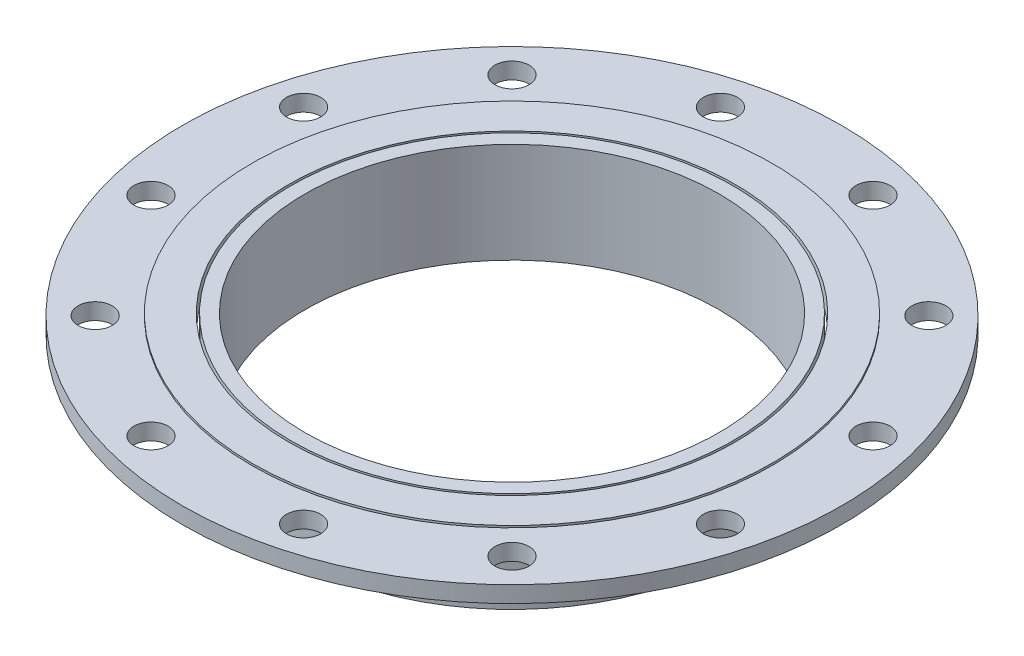
from build123d import *

# Parameters (mm, degrees)
SKETCH9_R           = 241.5
SKETCH9_R_2         = 163.6
BOSS_EXTRUDE1_DEPTH = 12
SKETCH10_R          = 12.5
CUT_EXTRUDE1_DEPTH  = 12
CIRPATTERN1_COUNT   = 12
SKETCH11_R          = 190.5
SKETCH11_R_2        = 163.6
BOSS_EXTRUDE2_DEPTH = 1.5
SKETCH12_R          = 161.95
SKETCH12_R_2        = 151.64
BOSS_EXTRUDE3_DEPTH = 73.5


with BuildPart() as part:
    # Sketch9 → Boss-Extrude1 (new body)
    with BuildSketch(Plane(origin=(0, 400, 0), x_dir=(1, 0, 0), z_dir=(0, 1, 0))):
        Circle(SKETCH9_R)
        Circle(SKETCH9_R_2, mode=Mode.SUBTRACT)
    extrude(amount=BOSS_EXTRUDE1_DEPTH)

    # Sketch10 → Cut-Extrude1 (cut)
    with BuildSketch(Plane(origin=(0, 412, 0), x_dir=(1, 0, 0), z_dir=(0, 1, 0))):
        with Locations((-55.904913742, 208.639978478)):
            Circle(SKETCH10_R)
    cut_extrude1 = extrude(amount=-CUT_EXTRUDE1_DEPTH, mode=Mode.SUBTRACT)

    # CirPattern1: Cut-Extrude1 ×12 about axis
    cirpattern1_axis = Axis((0, 456.058312806, 0), (0, -1, 0))
    for i in range(1, CIRPATTERN1_COUNT):
        add(cut_extrude1.rotate(cirpattern1_axis, i * 360 / CIRPATTERN1_COUNT), mode=Mode.SUBTRACT)

    # Sketch11 → Boss-Extrude2 (add)
    with BuildSketch(Plane(origin=(0, 412, 0), x_dir=(1, 0, 0), z_dir=(0, 1, 0))):
        Circle(SKETCH11_R)
        Circle(SKETCH11_R_2, mode=Mode.SUBTRACT)
    extrude(amount=BOSS_EXTRUDE2_DEPTH)


with BuildPart() as body_2:
    # Sketch12 → Boss-Extrude3 (new body)
    with BuildSketch(Plane(origin=(0, 413.5, 0), x_dir=(1, 0, 0), z_dir=(0, 1, 0))):
        Circle(SKETCH12_R)
        Circle(SKETCH12_R_2, mode=Mode.SUBTRACT)
    extrude(amount=-BOSS_EXTRUDE3_DEPTH)


solid = Compound([part.part, body_2.part])
